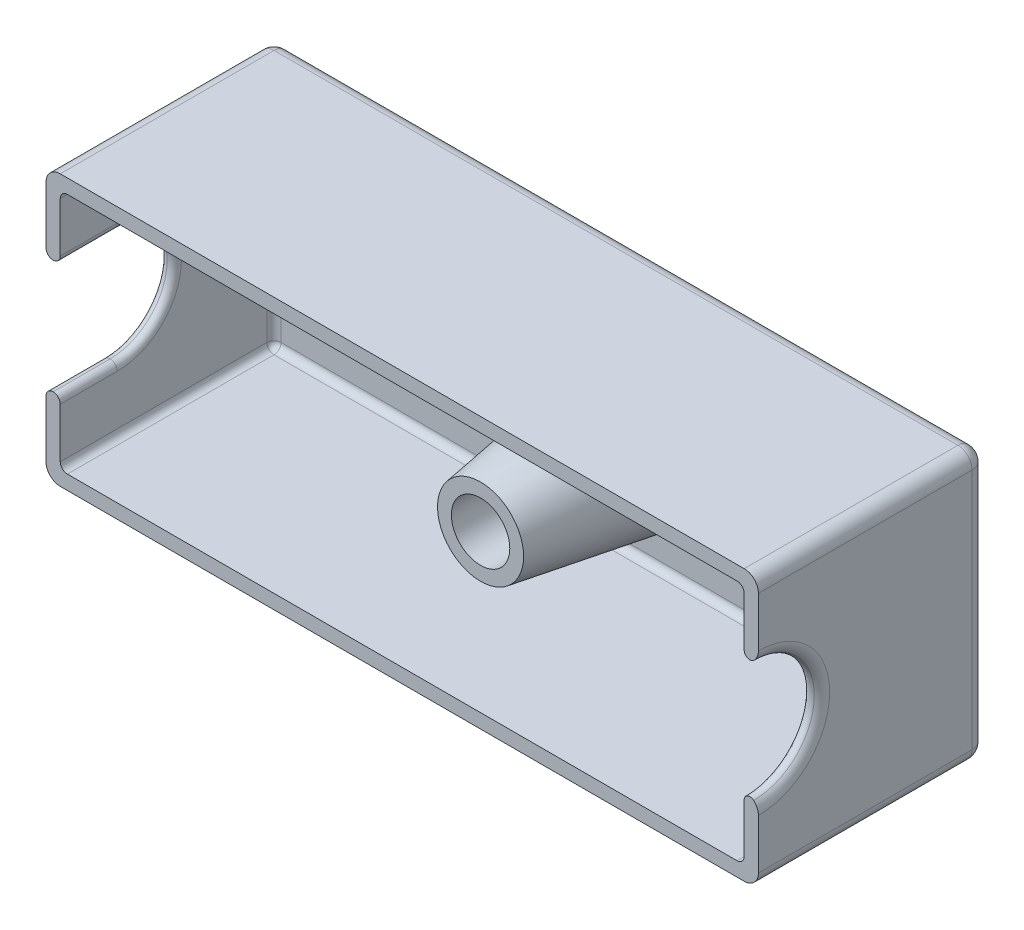
from build123d import *

# Parameters (mm, degrees)
ESBO_O1_W                  = 50
ESBO_O1_H                  = 19
ESBO_O1_W_2                = 48
ESBO_O1_H_2                = 17
RESSALTO_EXTRUS_O1_DEPTH   = 15
ESBO_O2_W                  = 50
ESBO_O2_H                  = 19
RESSALTO_EXTRUS_O2_DEPTH   = 1
ESBO_O3_R                  = 3
RESSALTO_EXTRUS_O3_DEPTH   = 12.5
CHANFRO1_SIZE              = 2
CHANFRO1_SIZE_2            = 12.627503029
ESBO_O4_R                  = 4
CORTE_EXTRUS_O1_DEPTH      = 4
FILETE2_R                  = 1
CORTE_EXTRUS_O2_DEPTH      = 54.058929503
CORTE_EXTRUS_O2_DEPTH_BACK = 3
CORTE_EXTRUS_O3_DEPTH      = 3
FILETE4_R                  = 1
ESBO_O7_R                  = 2.05
CORTE_EXTRUS_O4_DEPTH      = 15
FILETE5_R                  = 1
ESBO_O8_R                  = 1.75
CORTE_EXTRUS_O5_DEPTH      = 3
FILETE6_R                  = 0.5
FILETE10_R                 = 0.5
FILETE11_R                 = 0.5
FILETE14_R                 = 0.4
FILETE17_R                 = 0.5


# Some blends are built 0.0001 mm under size
with BuildPart() as part:
    # Esboço1 → Ressalto-extrusão1 (new body)
    with BuildSketch(Plane.XY):
        Rectangle(ESBO_O1_W, ESBO_O1_H)
        Rectangle(ESBO_O1_W_2, ESBO_O1_H_2, mode=Mode.SUBTRACT)
    extrude(amount=RESSALTO_EXTRUS_O1_DEPTH)

    # Esboço2 → Ressalto-extrusão2 (add)
    with BuildSketch(Plane(origin=(0, 0, 0), x_dir=(-1, 0, 0), z_dir=(0, 0, -1))):
        Rectangle(ESBO_O2_W, ESBO_O2_H)
    extrude(amount=RESSALTO_EXTRUS_O2_DEPTH)

    # Esboço3 → Ressalto-extrusão3 (add)
    with BuildSketch(Plane.XY):
        with Locations((3, 0)):
            Circle(ESBO_O3_R)
    extrude(amount=RESSALTO_EXTRUS_O3_DEPTH)

    # Chanfro1
    # the kernel refuses this chamfer: 12.627503029, 2 mm, written as the material it adds along each edge
    with BuildSketch(Plane(origin=(3, 0, 0), x_dir=(1, 0, 0), z_dir=(0, -1, 0))) as chanfro1_piece_1_section:
        Polygon((3 + CHANFRO1_SIZE, 0), (3, CHANFRO1_SIZE_2), (3, 0), align=None)
    chanfro1_piece_1 = revolve(axis=Axis((3, 0, 0), (0, 0, 1)), mode=Mode.PRIVATE)
    chanfro1_piece_1 = split(chanfro1_piece_1, bisect_by=Plane(origin=(-0.978781541, 0, 12.5), z_dir=(0, 0, -1)), keep=Keep.TOP, mode=Mode.PRIVATE)
    add(chanfro1_piece_1)

    # Esboço4 → Corte-extrusão1 (cut)
    with BuildSketch(Plane.XY.offset(-1)):
        with Locations((3, 0)):
            Circle(ESBO_O4_R)
    extrude(amount=CORTE_EXTRUS_O1_DEPTH, mode=Mode.SUBTRACT)

    # Filete2
    filete2_edges = [part.edges().sort_by_distance(p)[0] for p in [
        (25, 0, -1),
        (0, -9.5, -1),
        (-25, 0, -1),
        (0, 9.5, -1),
        (-25, 9.5, 7),
        (25, 9.5, 7),
        (25, -9.5, 7),
        (-25, -9.5, 7),
    ]]
    fillet(filete2_edges, radius=FILETE2_R)

    # Esboço5 → Corte-extrusão2 (cut, two sides: drawn at the far end of the back side and taken through both)
    with BuildSketch(Plane.ZY.offset(25).offset(-CORTE_EXTRUS_O2_DEPTH_BACK)):
        with BuildLine():
            Line((66.868842831, 4), (15, 4))
            Line((15, 4), (11, 4))
            ThreePointArc((11, 4), (7, 0), (11, -4))
            Line((11, -4), (15, -4))
            Line((15, -4), (66.868842831, -4))
            Line((66.868842831, -4), (170.606528493, -4))
            Line((170.606528493, -4), (170.606528493, 4))
            Line((170.606528493, 4), (66.868842831, 4))
        make_face()
    extrude(amount=CORTE_EXTRUS_O2_DEPTH + CORTE_EXTRUS_O2_DEPTH_BACK, mode=Mode.SUBTRACT)

    # Esboço6 → Corte-extrusão3 (cut)
    with BuildSketch(Plane(origin=(25, 0, 0), x_dir=(0, 0, -1), z_dir=(1, 0, 0))):
        with BuildLine():
            Line((-15, 4), (-15, -4))
            ThreePointArc((-15, -4), (-11, 0), (-15, 4))
        make_face()
    extrude(amount=-CORTE_EXTRUS_O3_DEPTH, mode=Mode.SUBTRACT)

    # Filete4
    filete4_edges = [part.edges().sort_by_distance(p)[0] for p in [
        (25, 0, 11),
    ]]
    fillet(filete4_edges, radius=FILETE4_R - 0.0001)  # a hair under: the kernel refuses the full size

    # Esboço7 → Corte-extrusão4 (cut)
    with BuildSketch(Plane.XY.offset(12.5)):
        with Locations((3, 0)):
            Circle(ESBO_O7_R)
    extrude(amount=-CORTE_EXTRUS_O4_DEPTH, mode=Mode.SUBTRACT)

    # Filete5
    filete5_edges = [part.edges().sort_by_distance(p)[0] for p in [
        (-1, 0, -1),
    ]]
    fillet(filete5_edges, radius=FILETE5_R)

    # Esboço8 → Corte-extrusão5 (cut)
    with BuildSketch(Plane(origin=(0, 0, -1), x_dir=(-1, 0, 0), z_dir=(0, 0, -1))):
        with Locations((3.12, 5.39)):
            Circle(ESBO_O8_R)
    extrude(amount=-CORTE_EXTRUS_O5_DEPTH, mode=Mode.SUBTRACT)

    # Filete6
    filete6_edges = [part.edges().sort_by_distance(p)[0] for p in [
        (-1.37, 5.39, 0),
        (-1.37, 5.39, -1),
    ]]
    fillet(filete6_edges, radius=FILETE6_R - 0.0001)  # a hair under: the kernel refuses the full size

    # Filete10
    filete10_edges = [part.edges().sort_by_distance(p)[0] for p in [
        (-24, 0, 0),
        (0, -8.5, 0),
        (24, 0, 0),
    ]]
    fillet(filete10_edges, radius=FILETE10_R)

    # Filete11
    # the kernel refuses this fillet: 0.5 mm, written as the material it adds along each edge
    with BuildSketch(Plane(origin=(-23.5, -8, 0.5), x_dir=(0, -1, 0), z_dir=(-1, 0, 0))) as filete11_piece_1_section:
        Polygon((0, 0), (FILETE11_R, 0), (FILETE11_R, -FILETE11_R), (0, -FILETE11_R), align=None)
    filete11_piece_1 = extrude(amount=FILETE11_R, mode=Mode.PRIVATE)
    filete11_piece_1 = filete11_piece_1 - Plane(origin=(-23.5, -8, 0.5), x_dir=(0, 0.7071067811865475, 0.7071067811865475), z_dir=(-1, 0, 0)) * Sphere(FILETE11_R, mode=Mode.PRIVATE)
    add(filete11_piece_1)
    with BuildSketch(Plane(origin=(23.5, -8, 0.5), x_dir=(0, -1, 0), z_dir=(1, 0, 0))) as filete11_piece_2_section:
        Polygon((0, 0), (FILETE11_R, 0), (FILETE11_R, FILETE11_R), (0, FILETE11_R), align=None)
    filete11_piece_2 = extrude(amount=FILETE11_R, mode=Mode.PRIVATE)
    filete11_piece_2 = filete11_piece_2 - Plane(origin=(23.5, -8, 0.5), x_dir=(0, 0.7071067811865475, 0.7071067811865475), z_dir=(1, 0, 0)) * Sphere(FILETE11_R, mode=Mode.PRIVATE)
    add(filete11_piece_2)
    with BuildSketch(Plane(origin=(-23.5, 8.5, 0), x_dir=(0, -1, 0), z_dir=(1, 0, 0))) as filete11_piece_3:
        with BuildLine():
            CenterArc((FILETE11_R, -FILETE11_R), FILETE11_R, 90, 90)
            Line((0, -FILETE11_R), (0, 0))
            Line((0, 0), (FILETE11_R, 0))
        make_face()
    extrude(amount=47)
    with BuildSketch(Plane(origin=(-23.5, 8.5, 0.5), x_dir=(0, 0, -1), z_dir=(1, 0, 0))) as filete11_piece_4:
        with BuildLine():
            CenterArc((0.5 - FILETE11_R, -FILETE11_R), FILETE11_R, 0, 90)
            Line((0.5, -FILETE11_R), (0.5, 0))
            Line((0.5, 0), (0.5 - FILETE11_R, 0))
        make_face()
    revolve(axis=Axis((-23.5, 8.5, 0.5), (0, 1, 0)), revolution_arc=90)
    with BuildSketch(Plane(origin=(23.5, 8.5, 0.5), x_dir=(0, 0, -1), z_dir=(-1, 0, 0))) as filete11_piece_5:
        with BuildLine():
            CenterArc((0.5 - FILETE11_R, FILETE11_R), FILETE11_R, 270, 90)
            Line((0.5, FILETE11_R), (0.5, 0))
            Line((0.5, 0), (0.5 - FILETE11_R, 0))
        make_face()
    revolve(axis=Axis((23.5, 8.5, 0.5), (0, -1, 0)), revolution_arc=90)
    with BuildSketch(Plane(origin=(-24, 8.5, 0.5), x_dir=(1, 0, 0), z_dir=(0, 0, 1)), Plane(origin=(-24, -8.5, 0.5), x_dir=(0, 1, 0), z_dir=(0, 0, 1))) as filete11_piece_6:
        with BuildLine():
            CenterArc((FILETE11_R, -FILETE11_R), FILETE11_R, 90, 90)
            Line((0, -FILETE11_R), (0, 0))
            Line((0, 0), (FILETE11_R, 0))
        make_face()
    extrude(amount=14.5)
    with BuildSketch(Plane(origin=(24, -8.5, 0.5), x_dir=(0, 1, 0), z_dir=(0, 0, 1)), Plane(origin=(24, 8.5, 0.5), x_dir=(-1, 0, 0), z_dir=(0, 0, 1))) as filete11_piece_7:
        with BuildLine():
            CenterArc((FILETE11_R, FILETE11_R), FILETE11_R, 180, 90)
            Line((0, FILETE11_R), (0, 0))
            Line((0, 0), (FILETE11_R, 0))
        make_face()
    extrude(amount=14.5)

    # Filete14
    filete14_edges = [part.edges().sort_by_distance(p)[0] for p in [
        (24, 0, 11),
    ]]
    fillet(filete14_edges, radius=FILETE14_R)

    # Filete17
    filete17_edges = [part.edges().sort_by_distance(p)[0] for p in [
        (-24, 4, 13),
        (-24, -4, 13),
        (-25, -4, 13),
        (-25, 4, 13),
        (-24, 0, 7),
        (-25, 0, 7),
    ]]
    fillet(filete17_edges, radius=FILETE17_R - 0.0001)  # a hair under: the kernel refuses the full size


solid = part.part
